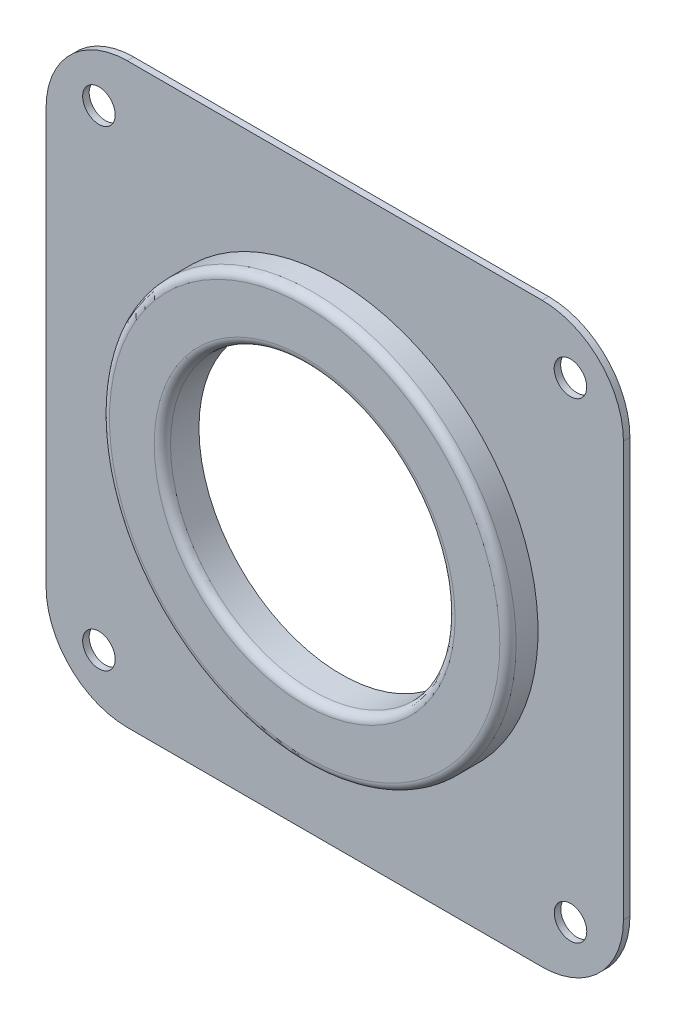
from build123d import *

# Parameters (mm, degrees)
SKETCH_1_W            = 71
SKETCH_1_H            = 71
EXTRUDE_1_DEPTH       = 0.8
SKETCH_2_W            = 25
SKETCH_2_H            = 3.7
HOLE_WIZARD_M30_1_D   = 35
HOLE_WIZARD_4_0_4_1_D = 4
FILLET_1_R            = 1
FILLET_2_R            = 10


with BuildPart() as part:
    # 草图1 → 凸台-拉伸1 (new body)
    with BuildSketch(Plane.XY.offset(1)):
        Rectangle(SKETCH_1_W, SKETCH_1_H)
    extrude(amount=-EXTRUDE_1_DEPTH)

    # 草图2 → 旋转1 (revolve)
    with BuildSketch(Plane.XZ):
        with Locations((12.5, 2.85)):
            Rectangle(SKETCH_2_W, SKETCH_2_H)
    revolve(axis=Axis((0, 0, 4.7), (0, 0, -1)))

    # M30 间隙孔1 (through all)
    with Locations(Plane.XY.offset(4.7)):
        with Locations((0, 0)):
            Hole(HOLE_WIZARD_M30_1_D / 2)

    # Ø4.0 (4) 直径孔1 (through all)
    with Locations(Plane.XY.offset(1)):
        with Locations((-29, 28.98), (-29, -29), (28.992753946, -28.992756445), (28.982756057, 28.982756057)):
            Hole(HOLE_WIZARD_4_0_4_1_D / 2)

    # 圆角1
    fillet_1_edges = [part.edges().sort_by_distance(p)[0] for p in [
        (17.5, 0, 4.7),
        (-25, 0, 4.7),
    ]]
    fillet(fillet_1_edges, radius=FILLET_1_R)

    # 圆角2
    fillet_2_edges = [part.edges().sort_by_distance(p)[0] for p in [
        (35.5, -35.5, 0.6),
        (-35.5, -35.5, 0.6),
        (-35.5, 35.5, 0.6),
        (35.5, 35.5, 0.6),
    ]]
    fillet(fillet_2_edges, radius=FILLET_2_R)


solid = part.part
